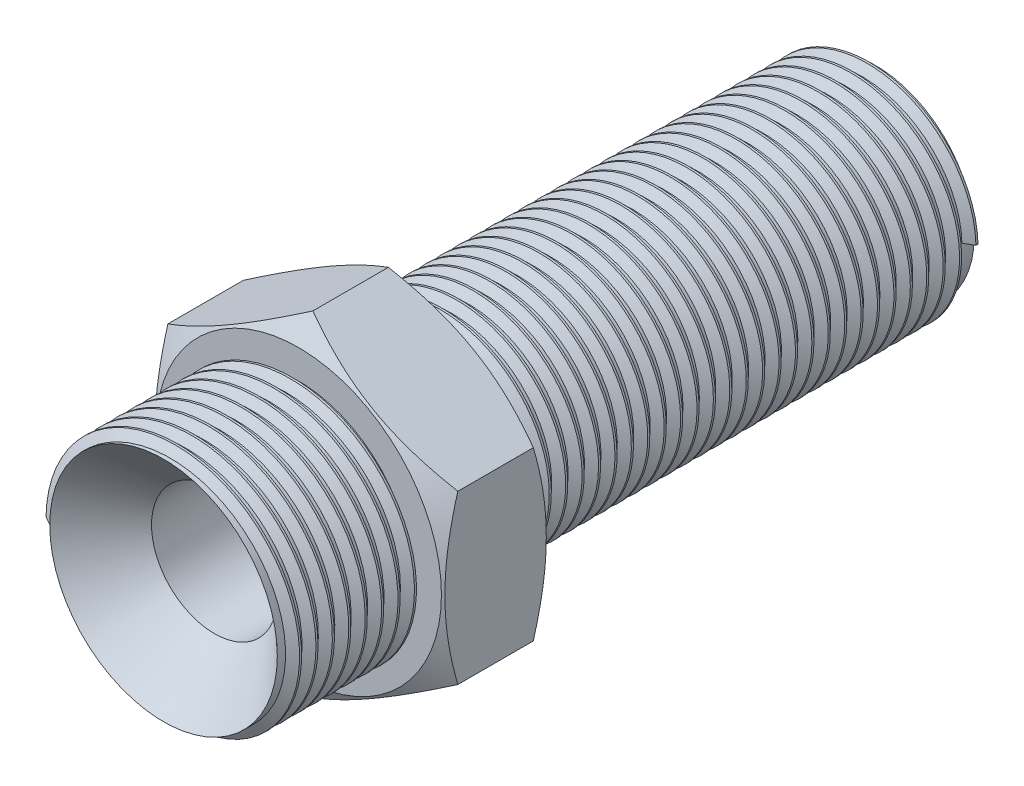
from build123d import *

# Parameters (mm, degrees)
Y_KSEKLIK_EKSTR_ZYON1_DEPTH = 9.5
IZIM2_R                     = 10.4
Y_KSEKLIK_EKSTR_ZYON3_DEPTH = 14.5
IZIM4_R                     = 9
Y_KSEKLIK_EKSTR_ZYON5_DEPTH = 45
IZIM12_R                    = 5.75
KES_EKSTR_ZYON1_DEPTH       = 100
PAH2_SIZE                   = 6.8
PAH3_SIZE                   = 5
DI_3_PITCH                  = 1.5
DI_4_PITCH                  = 1.5


with BuildPart() as part:
    # Çizim1 → Yükseklik-Ekstrüzyon1 (new body)
    with BuildSketch(Plane.XY):
        Polygon((0, -15.299782134), (13.25, -7.649891067), (13.25, 7.649891067), (0, 15.299782134), (-13.25, 7.649891067), (-13.25, -7.649891067), align=None)
    extrude(amount=Y_KSEKLIK_EKSTR_ZYON1_DEPTH)

    # Çizim2 → Yükseklik-Ekstrüzyon3 (add)
    with BuildSketch(Plane.XY.offset(9.5)):
        with Locations(Location((0, 0, 0), (0, 0, 180))):
            Circle(IZIM2_R)
    extrude(amount=Y_KSEKLIK_EKSTR_ZYON3_DEPTH)

    # Çizim4 → Yükseklik-Ekstrüzyon5 (add)
    with BuildSketch(Plane(origin=(0, 0, 0), x_dir=(-1, 0, 0), z_dir=(0, 0, -1))):
        with Locations(Location((0, 0, 0), (0, 0, 180))):
            Circle(IZIM4_R)
    extrude(amount=Y_KSEKLIK_EKSTR_ZYON5_DEPTH)

    # Çizim12 → Kes-Ekstrüzyon1 (cut)
    with BuildSketch(Plane.XY.offset(24)):
        Circle(IZIM12_R)
    extrude(amount=-KES_EKSTR_ZYON1_DEPTH, mode=Mode.SUBTRACT)

    # Pah2
    # the kernel refuses this chamfer: 6.8 mm, written as the material it takes off along each edge
    with BuildSketch(Plane(origin=(0, 0, 24), x_dir=(1, 0, 0), z_dir=(0, -1, 0))) as pah2_piece_1:
        Polygon((5.75 + PAH2_SIZE, 0), (5.75, -PAH2_SIZE), (5.75, 0), align=None)
    revolve(axis=Axis((0, 0, 24), (0, 0, 1)), mode=Mode.SUBTRACT)

    # Pah3
    # the kernel refuses this chamfer: 5 mm, written as the material it takes off along each edge
    with BuildSketch(Plane(origin=(0, 0, -45), x_dir=(1, 0, 0), z_dir=(0, -1, 0))) as pah3_piece_1:
        Polygon((5.75 + PAH3_SIZE, 0), (5.75, PAH3_SIZE), (5.75, 0), align=None)
    revolve(axis=Axis((0, 0, -45), (0, 0, 1)), mode=Mode.SUBTRACT)

    # Diş3: arcs per turn and ends read off the stored shape
    # Diş3: the profile of Diş Profili11 profile screwed along a right-hand helix through 8 turns, 8 arcs to a turn; built about Z, then put on its axis
    di_3_z = Axis((0, 0, 0), (0, 0, 1))
    di_3_corners = [(10.3997, 0, -0.000173205), (11.211898813, 0, 0.468749998), (11.211898813, 0, 0.656249998), (10.3997, 0, 1.125173201)]
    with BuildLine(mode=Mode.PRIVATE) as di_3_profile:
        Line(di_3_corners[0], di_3_corners[1])
        Line(di_3_corners[1], di_3_corners[2])
        Line(di_3_corners[2], di_3_corners[3])
        Line(di_3_corners[3], di_3_corners[0])
    di_3_cap = Face(di_3_profile.wire())
    di_3_turn_angles = [0, 22.5, 45, 67.5, 90, 112.5, 135, 157.5, 180, 202.5, 225, 247.5, 270, 292.5, 315, 337.5, 360]
    di_3_turn_weights = [1, 0.9238795325112867, 1, 0.9238795325112867, 1, 0.9238795325112867, 1, 0.9238795325112867, 1, 0.9238795325112867, 1, 0.9238795325112867, 1, 0.9238795325112867, 1, 0.9238795325112867, 1]
    di_3_turn_rails = [Edge.make_bspline([Vector(p[0], p[1], 0).rotate(di_3_z, di_3_turn_angles[k]) / di_3_turn_weights[k] + Vector(0, 0, p[2] + DI_3_PITCH * di_3_turn_angles[k] / 360) for k in range(17)], [0, 0, 0, 1, 1, 2, 2, 3, 3, 4, 4, 5, 5, 6, 6, 7, 7, 8, 8, 8], 2, di_3_turn_weights) for p in di_3_corners]
    di_3_turn_sides = [Face.make_surface_from_curves(di_3_turn_rails[p[0]], di_3_turn_rails[p[1]]) for p in [(0, 1), (1, 2), (2, 3), (3, 0)]]
    di_3 = Plane(origin=(0, 0, 21.85), x_dir=(-1, 0, 0), z_dir=(0, 0, -1)) * Solid(Shell([*[p.moved(Location((0, 0, DI_3_PITCH * i))) for i in range(8) for p in di_3_turn_sides], di_3_cap, di_3_cap.rotate(di_3_z, 2880).moved(Location((0, 0, DI_3_PITCH * 2880 / 360)))]))
    add(di_3)

    # Diş4: arcs per turn and ends read off the stored shape
    # Diş4: the profile of Diş Profili12 profile screwed along a right-hand helix through 28.666667 turns, 8 arcs to a turn; built about Z, then put on its axis
    di_4_z = Axis((0, 0, 0), (0, 0, 1))
    di_4_corners = [(8.9997, 0, -0.000173205), (9.811898813, 0, 0.468749998), (9.811898813, 0, 0.656249998), (8.9997, 0, 1.125173201)]
    with BuildLine(mode=Mode.PRIVATE) as di_4_profile:
        Line(di_4_corners[0], di_4_corners[1])
        Line(di_4_corners[1], di_4_corners[2])
        Line(di_4_corners[2], di_4_corners[3])
        Line(di_4_corners[3], di_4_corners[0])
    di_4_cap = Face(di_4_profile.wire())
    di_4_turn_angles = [0, 22.5, 45, 67.5, 90, 112.5, 135, 157.5, 180, 202.5, 225, 247.5, 270, 292.5, 315, 337.5, 360]
    di_4_turn_weights = [1, 0.9238795325112867, 1, 0.9238795325112867, 1, 0.9238795325112867, 1, 0.9238795325112867, 1, 0.9238795325112867, 1, 0.9238795325112867, 1, 0.9238795325112867, 1, 0.9238795325112867, 1]
    di_4_turn_rails = [Edge.make_bspline([Vector(p[0], p[1], 0).rotate(di_4_z, di_4_turn_angles[k]) / di_4_turn_weights[k] + Vector(0, 0, p[2] + DI_4_PITCH * di_4_turn_angles[k] / 360) for k in range(17)], [0, 0, 0, 1, 1, 2, 2, 3, 3, 4, 4, 5, 5, 6, 6, 7, 7, 8, 8, 8], 2, di_4_turn_weights) for p in di_4_corners]
    di_4_turn_sides = [Face.make_surface_from_curves(di_4_turn_rails[p[0]], di_4_turn_rails[p[1]]) for p in [(0, 1), (1, 2), (2, 3), (3, 0)]]
    di_4_last_angles = [10080, 10102.5, 10125, 10147.5, 10170, 10192.5, 10215, 10237.5, 10260, 10282.5, 10305, 10312.5, 10320]
    di_4_last_weights = [1, 0.9238795325112867, 1, 0.9238795325112867, 1, 0.9238795325112867, 1, 0.9238795325112867, 1, 0.9238795325112867, 1, 0.9914448613738125, 1]
    di_4_last_rails = [Edge.make_bspline([Vector(p[0], p[1], 0).rotate(di_4_z, di_4_last_angles[k]) / di_4_last_weights[k] + Vector(0, 0, p[2] + DI_4_PITCH * di_4_last_angles[k] / 360) for k in range(13)], [0, 0, 0, 1, 1, 2, 2, 3, 3, 4, 4, 5, 5, 6, 6, 6], 2, di_4_last_weights) for p in di_4_corners]
    di_4_last_sides = [Face.make_surface_from_curves(di_4_last_rails[p[0]], di_4_last_rails[p[1]]) for p in [(0, 1), (1, 2), (2, 3), (3, 0)]]
    di_4 = Plane(origin=(0, 0, -43.25), x_dir=(1, 0, 0), z_dir=(0, 0, 1)) * Solid(Shell([*[p.moved(Location((0, 0, DI_4_PITCH * i))) for i in range(28) for p in di_4_turn_sides], *di_4_last_sides, di_4_cap, di_4_cap.rotate(di_4_z, 10320).moved(Location((0, 0, DI_4_PITCH * 10320 / 360)))]))
    add(di_4)

    # Sketch1 → Cut-Revolve1 (revolve, cut)
    with BuildSketch(Plane(origin=(0, 0, 0), x_dir=(0, 0, -1), z_dir=(1, 0, 0)), mode=Mode.PRIVATE) as cut_revolve1_sk:
        Polygon((-9.5, 15.299782134), (-9.5, 13.049782134), (-8.2, 15.299782134), align=None)
        Polygon((0, 15.299782134), (-1.3, 15.299782134), (0, 13.049782134), align=None)
    revolve(cut_revolve1_sk.sketch.rotate(Axis((0, 0, 25.694334451), (0, 0, -1)), 90), axis=Axis((0, 0, 25.694334451), (0, 0, -1)), mode=Mode.SUBTRACT)


solid = part.part
